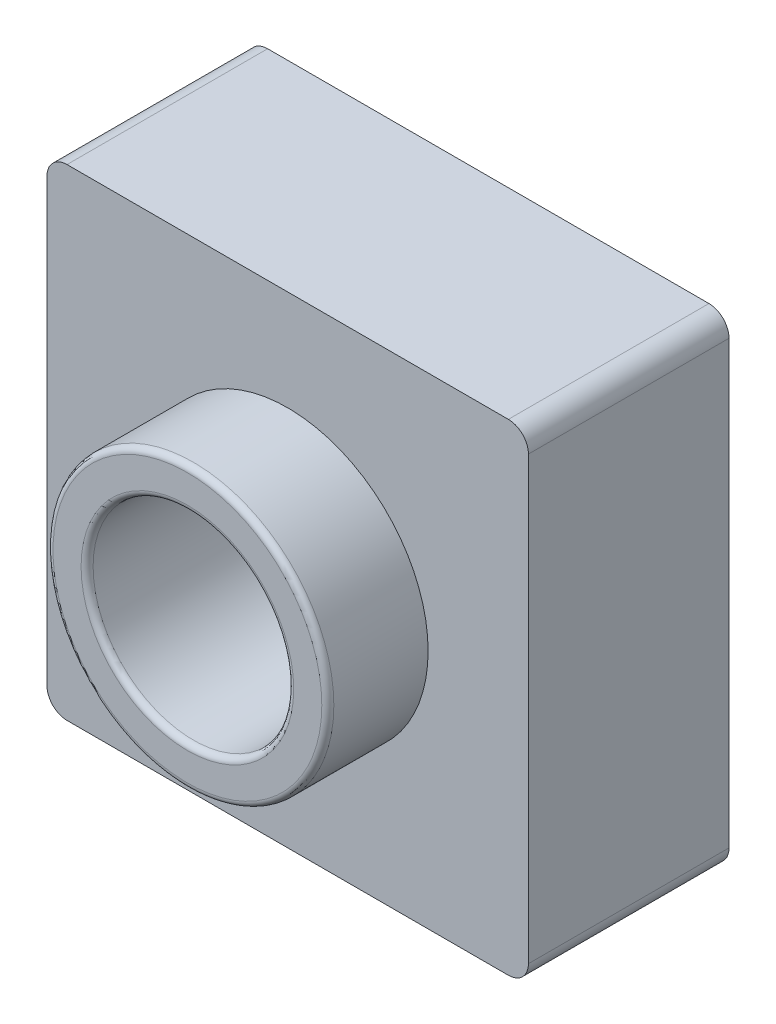
from build123d import *

# Parameters (mm, degrees)
SKETCH1_W           = 120
SKETCH1_H           = 120
BOSS_EXTRUDE1_DEPTH = 50
SKETCH4_R           = 35
BOSS_EXTRUDE3_DEPTH = 25
SKETCH5_R           = 25
CUT_EXTRUDE1_DEPTH  = 239.790170474
FILLET3_R           = 1.5
FILLET5_R           = 5


with BuildPart() as part:
    # Sketch1 → Boss-Extrude1 (new body)
    with BuildSketch(Plane.XY):
        with Locations((-142.772277228, 41.386138614)):
            Rectangle(SKETCH1_W, SKETCH1_H)
    extrude(amount=BOSS_EXTRUDE1_DEPTH)

    # Sketch4 → Boss-Extrude3 (add)
    with BuildSketch(Plane.XY.offset(50)):
        with Locations((-142.772277228, 41.386138614)):
            Circle(SKETCH4_R)
    extrude(amount=BOSS_EXTRUDE3_DEPTH)

    # Sketch5 → Cut-Extrude1 (cut, through all)
    with BuildSketch(Plane.XY.offset(75)):
        with Locations((-142.772277228, 41.386138614)):
            Circle(SKETCH5_R)
    extrude(amount=-CUT_EXTRUDE1_DEPTH, mode=Mode.SUBTRACT)

    # Fillet3
    fillet3_edges = [part.edges().sort_by_distance(p)[0] for p in [
        (-177.772277228, 41.386138614, 75),
        (-167.772277228, 41.386138614, 75),
    ]]
    fillet(fillet3_edges, radius=FILLET3_R)

    # Fillet5
    fillet5_edges = [part.edges().sort_by_distance(p)[0] for p in [
        (-82.772277228, -18.613861386, 25),
        (-202.772277228, 101.386138614, 25),
        (-82.772277228, 101.386138614, 25),
        (-202.772277228, -18.613861386, 25),
    ]]
    fillet(fillet5_edges, radius=FILLET5_R)


solid = part.part
